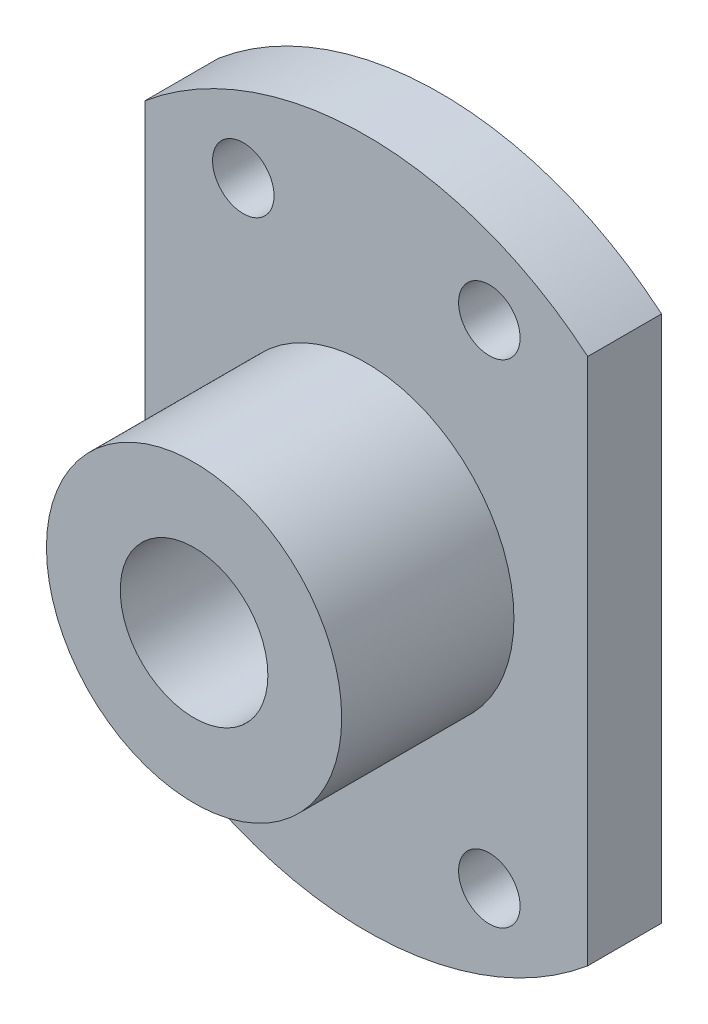
from build123d import *

# Parameters (mm, degrees)
SKETCH1_R               = 3
SKETCH1_R_2             = 1.25
BOSS_EXTRUDE1_DEPTH     = 3
SKETCH2_R               = 6
SKETCH2_R_2             = 3
LINEARBALLSUPPORT_DEPTH = 7


with BuildPart() as part:
    # Sketch1 → Boss-Extrude1 (new body)
    with BuildSketch(Plane.XY):
        with BuildLine():
            Line((-9, 10.723805295), (-9, -10.723805295))
            ThreePointArc((-9, -10.723805295), (0, -14), (9, -10.723805295))
            Line((9, -10.723805295), (9, 10.723805295))
            ThreePointArc((9, 10.723805295), (0, 14), (-9, 10.723805295))
        make_face()
        Circle(SKETCH1_R, mode=Mode.SUBTRACT)
        with Locations((-5, 10)):
            Circle(SKETCH1_R_2, mode=Mode.SUBTRACT)
        with Locations((5, 10)):
            Circle(SKETCH1_R_2, mode=Mode.SUBTRACT)
        with Locations((-5, -10)):
            Circle(SKETCH1_R_2, mode=Mode.SUBTRACT)
        with Locations((5, -10)):
            Circle(SKETCH1_R_2, mode=Mode.SUBTRACT)
    extrude(amount=BOSS_EXTRUDE1_DEPTH)

    # Sketch2 → LinearBallSupport (add)
    with BuildSketch(Plane.XY.offset(3)):
        Circle(SKETCH2_R)
        Circle(SKETCH2_R_2, mode=Mode.SUBTRACT)
    extrude(amount=LINEARBALLSUPPORT_DEPTH)


solid = part.part
